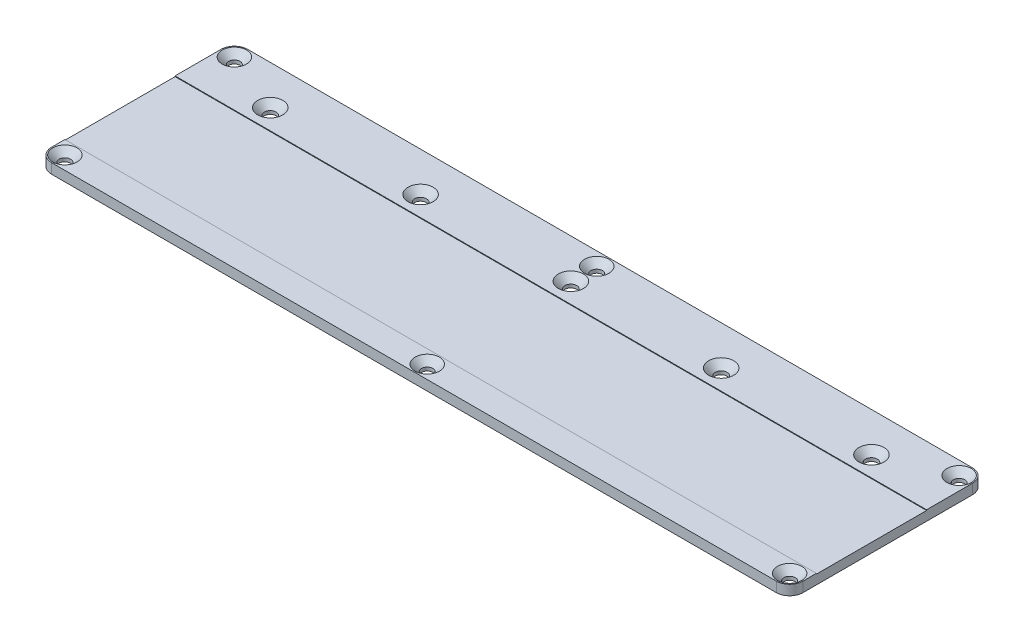
from build123d import *

# Parameters (mm, degrees)
SKETCH1_W                                    = 225
SKETCH1_H                                    = 58.75
BOSS_EXTRUDE1_DEPTH                          = 3
SKETCH3_R                                    = 1.767766953
CUT_EXTRUDE1_DEPTH                           = 118.384584273
CHAMFER2_SIZE                                = 2
SKETCH2_W                                    = 225
SKETCH2_H                                    = 33
CUT_EXTRUDE2_DEPTH                           = 0.2
FILLET1_R                                    = 4
CSK_FOR_M3_COUNTERSUNK_FLAT_HEAD_SCR_2_COUNT = 2
CSK_FOR_M3_COUNTERSUNK_FLAT_HEAD_SCR_2_PITCH = 50.75
CSK_FOR_M3_COUNTERSUNK_FLAT_HEAD_SCR_3_COUNT = 2
CSK_FOR_M3_COUNTERSUNK_FLAT_HEAD_SCR_3_PITCH = 222.855474467
CSK_FOR_M3_COUNTERSUNK_FLAT_HEAD_SCR_4_COUNT = 2
CSK_FOR_M3_COUNTERSUNK_FLAT_HEAD_SCR_4_PITCH = 217
CSK_FOR_M3_COUNTERSUNK_FLAT_HEAD_SCR_5_COUNT = 2
CSK_FOR_M3_COUNTERSUNK_FLAT_HEAD_SCR_5_PITCH = 108.5
CSK_FOR_M3_COUNTERSUNK_FLAT_HEAD_SCR_6_COUNT = 2
CSK_FOR_M3_COUNTERSUNK_FLAT_HEAD_SCR_6_PITCH = 119.782354711


with BuildPart() as part:
    # Sketch1 → Boss-Extrude1 (new body)
    with BuildSketch(Plane(origin=(0, 0, 0), x_dir=(1, 0, 0), z_dir=(0, 1, 0))):
        with Locations((0, -4)):
            Rectangle(SKETCH1_W, SKETCH1_H)
    extrude(amount=BOSS_EXTRUDE1_DEPTH)

    # Sketch3 → Cut-Extrude1 (cut, through all)
    with BuildSketch(Plane(origin=(0, 3, 0), x_dir=(1, 0, 0), z_dir=(0, 1, 0))):
        with Locations((0, 13.625)):
            Circle(SKETCH3_R)
        with Locations((45, 13.625)):
            Circle(SKETCH3_R)
        with Locations((90, 13.625)):
            Circle(SKETCH3_R)
        with Locations((-45, 13.625)):
            Circle(SKETCH3_R)
        with Locations((-90, 13.625)):
            Circle(SKETCH3_R)
    extrude(amount=-CUT_EXTRUDE1_DEPTH, mode=Mode.SUBTRACT)

    # Chamfer2
    chamfer2_edges = [part.edges().sort_by_distance(p)[0] for p in [
        (88.232233047, 3, -13.625),
        (43.232233047, 3, -13.625),
        (-1.767766953, 3, -13.625),
        (-46.767766953, 3, -13.625),
        (-91.767766953, 3, -13.625),
    ]]
    chamfer(chamfer2_edges, length=CHAMFER2_SIZE)

    # Sketch2 → Cut-Extrude2 (cut)
    with BuildSketch(Plane(origin=(0, 3, 0), x_dir=(1, 0, 0), z_dir=(0, 1, 0))):
        with Locations((0, -8.875)):
            Rectangle(SKETCH2_W, SKETCH2_H)
    extrude(amount=-CUT_EXTRUDE2_DEPTH, mode=Mode.SUBTRACT)

    # Fillet1
    fillet1_edges = [part.edges().sort_by_distance(p)[0] for p in [
        (-112.5, 1.5, -25.375),
        (112.5, 1.5, 33.375),
        (-112.5, 1.5, 33.375),
        (112.5, 1.5, -25.375),
    ]]
    fillet(fillet1_edges, radius=FILLET1_R)

    # Sketch5 → CSK for M3 Countersunk Flat Head Screw1 (revolve, cut)
    with BuildSketch(Plane(origin=(108.5, 3, -21.375), x_dir=(0, 0, 1), z_dir=(1, 0, 0))):
        Polygon((0, 0), (0, 3), (1.7, 3), (1.7, 1.95), (3.65, 0), align=None)
    csk_for_m3_countersunk_flat_head_screw1 = revolve(axis=Axis((108.5, 9.35, -21.375), (0, -1, 0)), mode=Mode.SUBTRACT)

    # CSK for M3 Countersunk Flat Head Scr 2: CSK for M3 Countersunk Flat Head Screw1 ×2
    with Locations(*[(0, 0, i * CSK_FOR_M3_COUNTERSUNK_FLAT_HEAD_SCR_2_PITCH) for i in range(1, CSK_FOR_M3_COUNTERSUNK_FLAT_HEAD_SCR_2_COUNT)]):
        add(csk_for_m3_countersunk_flat_head_screw1, mode=Mode.SUBTRACT)

    # CSK for M3 Countersunk Flat Head Scr 3: CSK for M3 Countersunk Flat Head Screw1 ×2
    with Locations(*[Vector(-0.973725238380626, 0, 0.22772606381482383) * (i * CSK_FOR_M3_COUNTERSUNK_FLAT_HEAD_SCR_3_PITCH) for i in range(1, CSK_FOR_M3_COUNTERSUNK_FLAT_HEAD_SCR_3_COUNT)]):
        add(csk_for_m3_countersunk_flat_head_screw1, mode=Mode.SUBTRACT)

    # CSK for M3 Countersunk Flat Head Scr 4: CSK for M3 Countersunk Flat Head Screw1 ×2
    with Locations(*[(-i * CSK_FOR_M3_COUNTERSUNK_FLAT_HEAD_SCR_4_PITCH, 0, 0) for i in range(1, CSK_FOR_M3_COUNTERSUNK_FLAT_HEAD_SCR_4_COUNT)]):
        add(csk_for_m3_countersunk_flat_head_screw1, mode=Mode.SUBTRACT)

    # CSK for M3 Countersunk Flat Head Scr 5: CSK for M3 Countersunk Flat Head Screw1 ×2
    with Locations(*[(-i * CSK_FOR_M3_COUNTERSUNK_FLAT_HEAD_SCR_5_PITCH, 0, 0) for i in range(1, CSK_FOR_M3_COUNTERSUNK_FLAT_HEAD_SCR_5_COUNT)]):
        add(csk_for_m3_countersunk_flat_head_screw1, mode=Mode.SUBTRACT)

    # CSK for M3 Countersunk Flat Head Scr 6: CSK for M3 Countersunk Flat Head Screw1 ×2
    with Locations(*[Vector(-0.9058095431685391, 0, 0.4236851089014134) * (i * CSK_FOR_M3_COUNTERSUNK_FLAT_HEAD_SCR_6_PITCH) for i in range(1, CSK_FOR_M3_COUNTERSUNK_FLAT_HEAD_SCR_6_COUNT)]):
        add(csk_for_m3_countersunk_flat_head_screw1, mode=Mode.SUBTRACT)


solid = part.part
